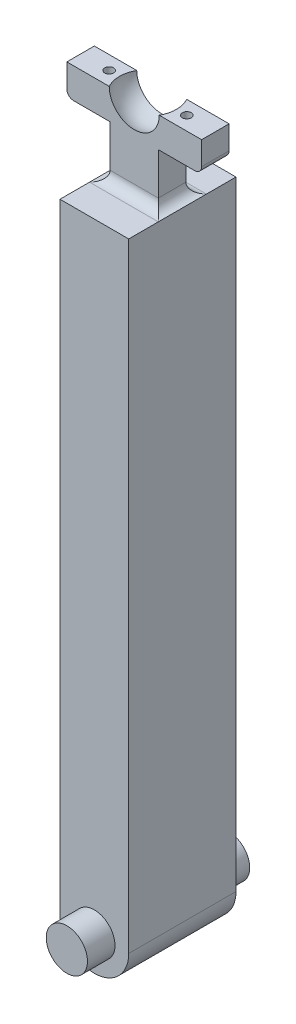
from build123d import *

# Parameters (mm, degrees)
EXTRUDE_1_DEPTH = 7.8
SKETCH_4_R      = 3
EXTRUDE_3_DEPTH = 4
SKETCH_5_W      = 7
SKETCH_5_H      = 4
EXTRUDE_4_DEPTH = 12
SKETCH_7_W      = 19.6
SKETCH_7_H      = 4.4
EXTRUDE_5_DEPTH = 2
FILLET_2_R      = 1
HOLE_WIZARD_1_D = 1.3
FILLET_3_R      = 1.5


with BuildPart() as part:
    # 草图1 → 凸台-拉伸1 (new, symmetric)
    with BuildSketch(Plane.XY):
        with BuildLine():
            Line((5, 0), (5, 90))
            Line((5, 90), (-5, 90))
            Line((-5, 90), (-5, 0))
            ThreePointArc((-5, 0), (0, -5), (5, 0))
        make_face()
    extrude(amount=EXTRUDE_1_DEPTH, both=True)

    # 草图4 → 凸台-拉伸3 (add)
    with BuildSketch(Plane.XY.offset(7.8)):
        Circle(SKETCH_4_R)
    extrude_3 = extrude(amount=EXTRUDE_3_DEPTH)

    # 草图5 → 凸台-拉伸4 (add)
    with BuildSketch(Plane(origin=(0, 102, 0), x_dir=(1, 0, 0), z_dir=(0, 1, 0))):
        Rectangle(SKETCH_5_W, SKETCH_5_H)
    extrude(amount=-EXTRUDE_4_DEPTH)

    # 草图7 → 凸台-拉伸5 (add, symmetric)
    with BuildSketch(Plane.XY):
        with Locations((0, 99.8)):
            Rectangle(SKETCH_7_W, SKETCH_7_H)
    extrude(amount=EXTRUDE_5_DEPTH, both=True)

    # 草图10 → 切除-旋转1 (revolve, cut)
    with BuildSketch(Plane.XY):
        with BuildLine():
            ThreePointArc((4.15, 102), (2.934493142, 104.934493142), (0, 106.15))
            Line((0, 106.15), (0, 102))
            Line((0, 102), (0, 97.85))
            ThreePointArc((0, 97.85), (2.934493142, 99.065506858), (4.15, 102))
        make_face()
    revolve(axis=Axis((0, 106.15, 0), (0, -1, 0)), mode=Mode.SUBTRACT)

    # 镜向2: 凸台-拉伸3 across plane
    add(extrude_3.mirror(Plane.XY))

    # 圆角2
    fillet_2_edges = [part.edges().sort_by_distance(p)[0] for p in [
        (-9.8, 97.6, 0),
        (9.8, 97.6, 0),
    ]]
    fillet(fillet_2_edges, radius=FILLET_2_R)

    # 孔1 (through all)
    with Locations(Plane(origin=(0, 97.6, 0), x_dir=(-1, 0, 0), z_dir=(0, -1, 0))):
        with Locations((5.65, 0), (-5.65, 0)):
            Hole(HOLE_WIZARD_1_D / 2)

    # 圆角3
    fillet_3_edges = [part.edges().sort_by_distance(p)[0] for p in [
        (0, 90, -2),
        (-3.5, 90, 0),
        (0, 90, 2),
        (3.5, 90, 0),
    ]]
    fillet(fillet_3_edges, radius=FILLET_3_R - 0.0001)  # a hair under: the kernel refuses the full size


solid = part.part
